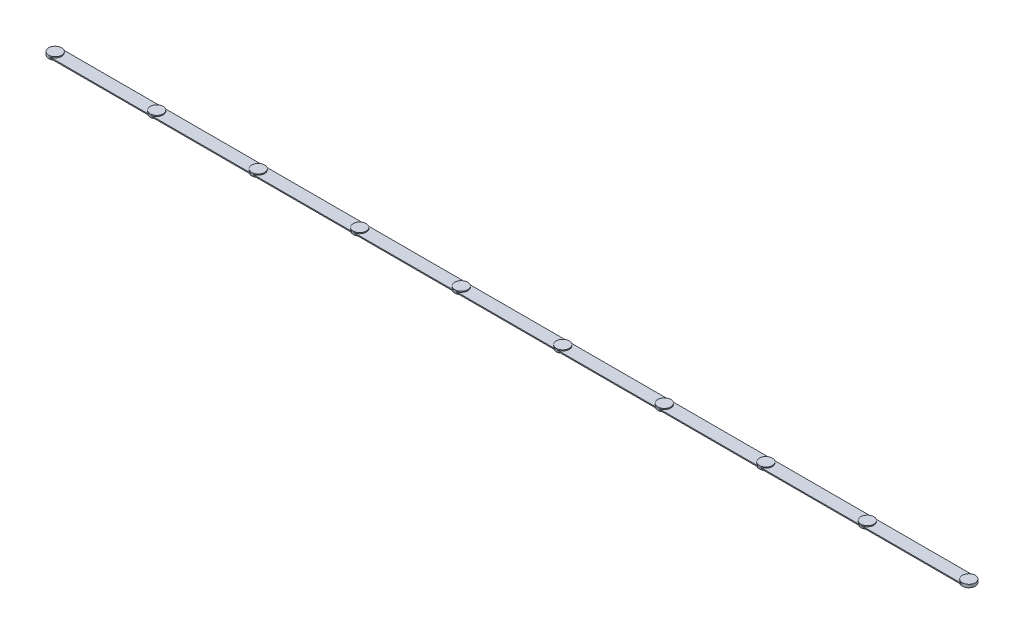
from build123d import *

# Parameters (mm, degrees)
BOSS_EXTRUDE1_DEPTH = 2
SKETCH2_R           = 12.75
BOSS_EXTRUDE2_DEPTH = 2
SKETCH3_R           = 12.75
CUT_EXTRUDE1_DEPTH  = 45
BOSS_EXTRUDE3_START = 2
SKETCH5_R           = 12.75
BOSS_EXTRUDE3_DEPTH = 2
LPATTERN3_COUNT     = 10
LPATTERN3_PITCH     = 200
CUT_EXTRUDE3_DEPTH  = 5


with BuildPart() as part:
    # Sketch1 → Boss-Extrude1 (new body)
    with BuildSketch(Plane(origin=(0, 0, 0), x_dir=(1, 0, 0), z_dir=(0, 1, 0))):
        with BuildLine():
            Line((0, -12.75), (200, -12.75))
            ThreePointArc((200, -12.75), (212.75, 0), (200, 12.75))
            Line((200, 12.75), (0, 12.75))
            ThreePointArc((0, 12.75), (-12.75, 0), (0, -12.75))
        make_face()
    extrude(amount=BOSS_EXTRUDE1_DEPTH)

    # Sketch2 → Boss-Extrude2 (add)
    with BuildSketch(Plane(origin=(0, 2, 0), x_dir=(1, 0, 0), z_dir=(0, 1, 0))):
        Circle(SKETCH2_R)
        with Locations((200, 0)):
            Circle(SKETCH2_R)
    extrude(amount=BOSS_EXTRUDE2_DEPTH)

    # Sketch3 → Cut-Extrude1 (cut)
    with BuildSketch(Plane.XZ):
        with Locations((200, 0)):
            Circle(SKETCH3_R)
    extrude(amount=-CUT_EXTRUDE1_DEPTH, mode=Mode.SUBTRACT)

    # Sketch5 → Boss-Extrude3 (add)
    with BuildSketch(Plane.XZ.offset(BOSS_EXTRUDE3_START)):
        Circle(SKETCH5_R)
    extrude(amount=-BOSS_EXTRUDE3_DEPTH)


with BuildPart() as lpattern3_1:
    # LPattern3: pattern copy
    add(part.part.moved(Location(Vector(1, 0, 0) * (1 * LPATTERN3_PITCH))))


with BuildPart() as lpattern3_2:
    # LPattern3: pattern copy
    add(part.part.moved(Location(Vector(1, 0, 0) * (2 * LPATTERN3_PITCH))))


with BuildPart() as lpattern3_3:
    # LPattern3: pattern copy
    add(part.part.moved(Location(Vector(1, 0, 0) * (3 * LPATTERN3_PITCH))))


with BuildPart() as lpattern3_4:
    # LPattern3: pattern copy
    add(part.part.moved(Location(Vector(1, 0, 0) * (4 * LPATTERN3_PITCH))))


with BuildPart() as lpattern3_5:
    # LPattern3: pattern copy
    add(part.part.moved(Location(Vector(1, 0, 0) * (5 * LPATTERN3_PITCH))))


with BuildPart() as lpattern3_6:
    # LPattern3: pattern copy
    add(part.part.moved(Location(Vector(1, 0, 0) * (6 * LPATTERN3_PITCH))))


with BuildPart() as lpattern3_7:
    # LPattern3: pattern copy
    add(part.part.moved(Location(Vector(1, 0, 0) * (7 * LPATTERN3_PITCH))))


with BuildPart() as lpattern3_8:
    # LPattern3: pattern copy
    add(part.part.moved(Location(Vector(1, 0, 0) * (8 * LPATTERN3_PITCH))))


with BuildPart() as lpattern3_9:
    # LPattern3: pattern copy
    add(part.part.moved(Location(Vector(1, 0, 0) * (9 * LPATTERN3_PITCH))))

    # Sketch6 → Cut-Extrude3 (cut)
    with BuildSketch(Plane.XZ):
        with BuildLine():
            Line((1800, 12.75), (2000, 12.75))
            Line((2000, 12.75), (2000, -12.75))
            Line((2000, -12.75), (1800, -12.75))
            ThreePointArc((1800, -12.75), (1812.75, 0), (1800, 12.75))
        make_face()
    extrude(amount=-CUT_EXTRUDE3_DEPTH, mode=Mode.SUBTRACT)


solid = Compound([part.part, lpattern3_1.part, lpattern3_2.part, lpattern3_3.part, lpattern3_4.part, lpattern3_5.part, lpattern3_6.part, lpattern3_7.part, lpattern3_8.part, lpattern3_9.part])
